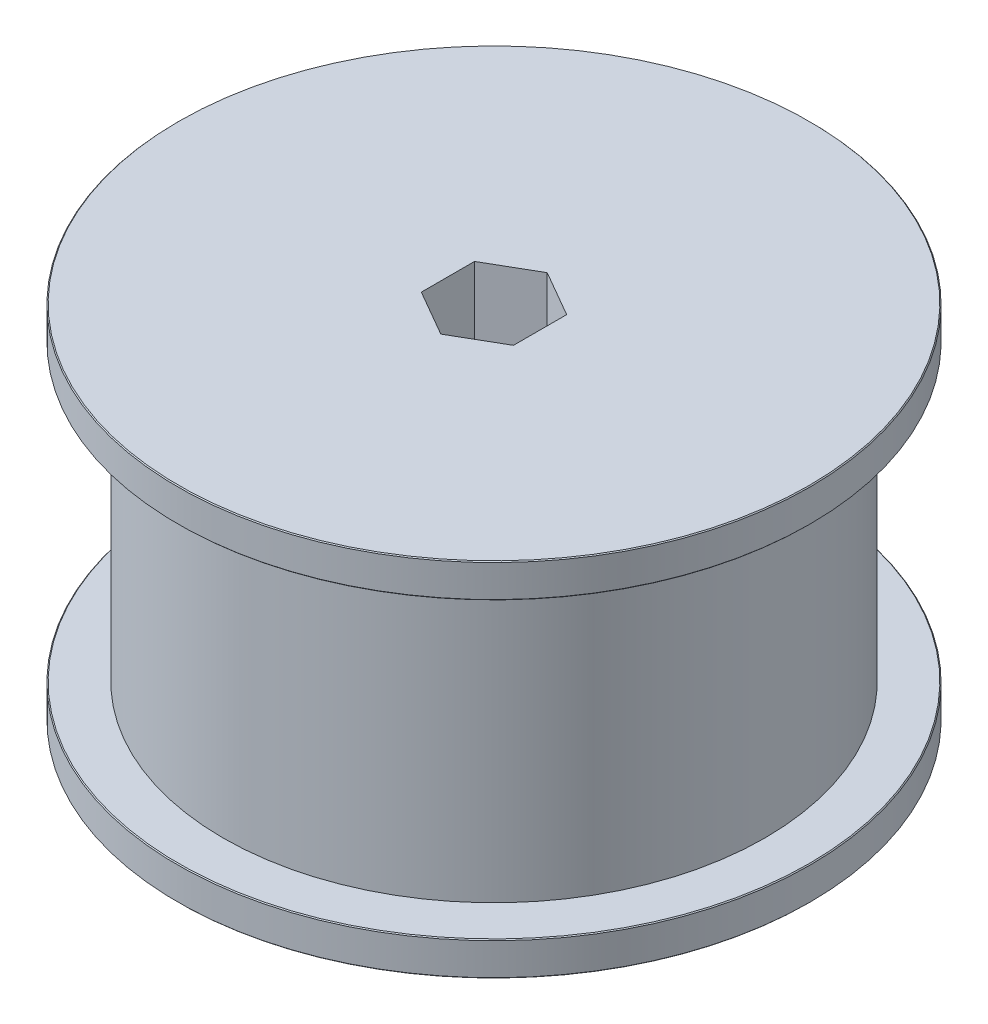
from build123d import *

# Parameters (mm, degrees)
CHAMFER1_SIZE           = 0.127
CUT_EXTRUDE1_DEPTH      = 81.82230509
CUT_EXTRUDE1_DEPTH_BACK = 81.82230509


with BuildPart() as part:
    # Sketch1 → Revolve1 (revolve)
    with BuildSketch(Plane.XY):
        Polygon((0, 0), (44.45, 0), (44.45, 4.7625), (38.1, 4.7625), (38.1, 46.0375), (44.45, 46.0375), (44.45, 50.8), (0, 50.8), (0, 46.0248), (0, 4.7752), align=None)
    revolve(axis=Axis((0, 50.8, 0), (0, -1, 0)))

    # Chamfer1
    chamfer1_edges = [part.edges().sort_by_distance(p)[0] for p in [
        (-44.45, 46.0375, 0),
        (-44.45, 4.7625, 0),
        (-44.45, 0, 0),
        (-44.45, 50.8, 0),
    ]]
    chamfer(chamfer1_edges, length=CHAMFER1_SIZE)

    # Sketch2 → Cut-Extrude1 (cut, two sides: drawn at the far end of the back side and taken through both)
    with BuildSketch(Plane.XZ.offset(-CUT_EXTRUDE1_DEPTH_BACK)):
        Polygon((0, 7.478995387), (-6.477, 3.739497694), (-6.477, -3.739497694), (0, -7.478995387), (6.477, -3.739497694), (6.477, 3.739497694), align=None)
    extrude(amount=CUT_EXTRUDE1_DEPTH + CUT_EXTRUDE1_DEPTH_BACK, mode=Mode.SUBTRACT)


solid = part.part
